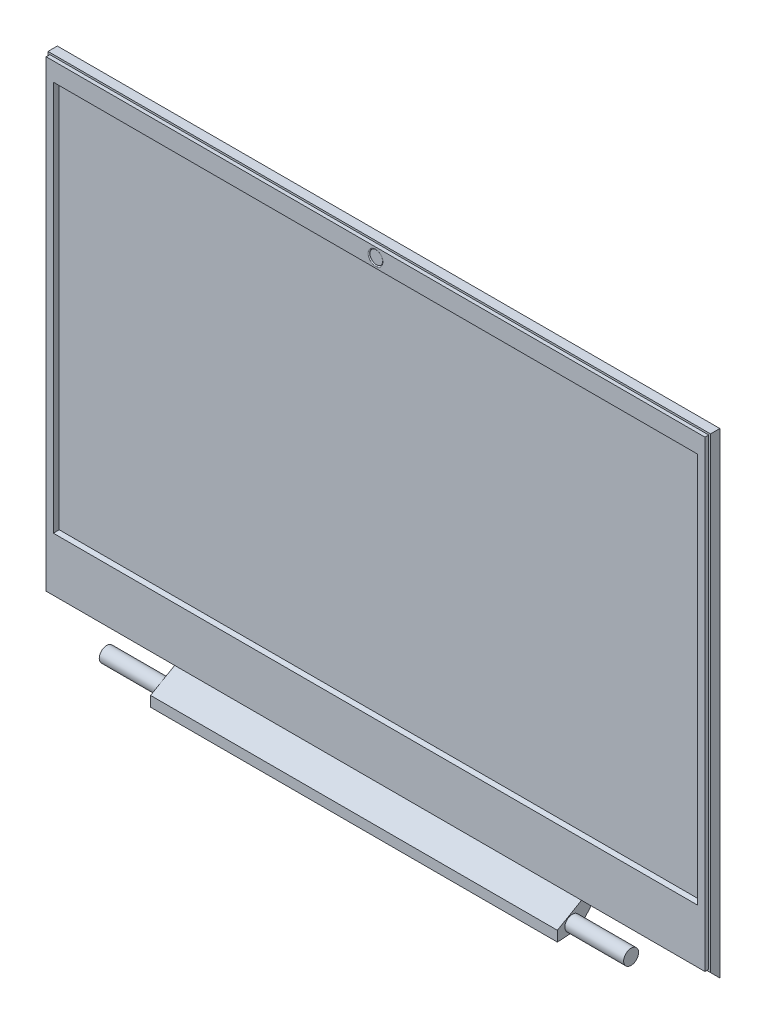
from build123d import *

# Parameters (mm, degrees)
EXTRUDE_1_DEPTH       = 177.5
EXTRUDE_2_DEPTH       = 109
EXTRUDE_3_DEPTH       = 2
SKETCH_5_W            = 355
SKETCH_5_H            = 250
SKETCH_5_W_2          = 353
SKETCH_5_H_2          = 248
CUT_EXTRUDE_1_DEPTH   = 2
SKETCH_6_W            = 343
SKETCH_6_H            = 207
CUT_EXTRUDE_1_2_DEPTH = 2
CHAMFER_1_SIZE        = 1.154
CHAMFER_1_SIZE2       = 1.998786632
SKETCH_7_R            = 3.5
CUT_EXTRUDE_2_DEPTH   = 0.5
FILLET_1_R            = 0.5
SKETCH_8_R            = 4
EXTRUDE_4_DEPTH       = 140.5


with BuildPart() as part:
    # 草图1 → 凸台-拉伸1 (new, symmetric)
    with BuildSketch(Plane(origin=(0, 0, 0), x_dir=(0, 0, -1), z_dir=(1, 0, 0))):
        Polygon((0, 0), (0, 255), (-5, 255), (-5, 5), align=None)
    extrude(amount=EXTRUDE_1_DEPTH, both=True)

    # 草图3 → 凸台-拉伸2 (add, symmetric)
    with BuildSketch(Plane(origin=(0, 0, 0), x_dir=(0, 0, -1), z_dir=(1, 0, 0))):
        Polygon((0, 0), (-6.583760775, -7.526891394), (-18.557046178, -8.32716426), (-18.557046178, -2.82716426), (-5, 5), align=None)
    extrude(amount=EXTRUDE_2_DEPTH, both=True)

    # 草图4 → 凸台-拉伸3 (add)
    with BuildSketch(Plane.XY.offset(5)):
        Polygon((-177.5, 255), (-177.5, 5), (-109, 5), (109, 5), (177.5, 5), (177.5, 255), align=None)
    extrude(amount=EXTRUDE_3_DEPTH)

    # 草图5 → Cut-Extrude 1 (cut)
    with BuildSketch(Plane.XY.offset(7)):
        with Locations((0, 130)):
            Rectangle(SKETCH_5_W, SKETCH_5_H)
        with Locations((0, 130)):
            Rectangle(SKETCH_5_W_2, SKETCH_5_H_2, mode=Mode.SUBTRACT)
    extrude(amount=-CUT_EXTRUDE_1_DEPTH, mode=Mode.SUBTRACT)

    # 草图6 → Cut-Extrude 1 2 (cut)
    with BuildSketch(Plane.XY.offset(7)):
        with Locations((0, 139.5)):
            Rectangle(SKETCH_6_W, SKETCH_6_H)
    extrude(amount=-CUT_EXTRUDE_1_2_DEPTH, mode=Mode.SUBTRACT)

    # 倒角1
    chamfer_1_edges = [part.edges().sort_by_distance(p)[0] for p in [
        (-171.5, 139.5, 7),
        (0, 36, 7),
        (171.5, 139.5, 7),
        (0, 243, 7),
    ]]
    chamfer_1_side = [part.faces().sort_by_distance(p)[0] for p in [
        (0, 10.314081594, 7),
    ]]
    chamfer(chamfer_1_edges, length=CHAMFER_1_SIZE, length2=CHAMFER_1_SIZE2, reference=chamfer_1_side[0])

    # 草图7 → 切除-拉伸2 (cut)
    with BuildSketch(Plane.XY.offset(7)):
        with Locations((0, 249)):
            Circle(SKETCH_7_R)
    extrude(amount=-CUT_EXTRUDE_2_DEPTH, mode=Mode.SUBTRACT)

    # 圆角1
    fillet_1_edges = [part.edges().sort_by_distance(p)[0] for p in [
        (-3.5, 249, 7),
    ]]
    fillet(fillet_1_edges, radius=FILLET_1_R - 0.0001)  # a hair under: the kernel refuses the full size

    # 草图8 → 凸台-拉伸4 (add, symmetric)
    with BuildSketch(Plane(origin=(0, 0, 0), x_dir=(0, 0, -1), z_dir=(1, 0, 0))):
        with Locations(Location((-10.557046178, -3.382641438, 0), (0, 0, 180))):
            Circle(SKETCH_8_R)
    extrude(amount=EXTRUDE_4_DEPTH, both=True)


solid = part.part
